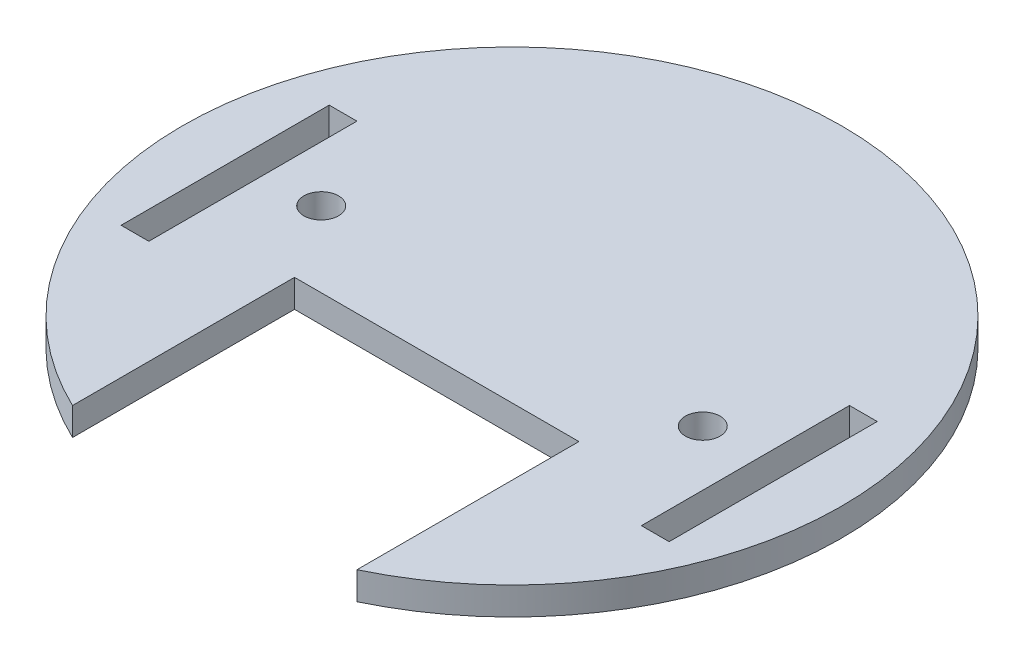
from build123d import *

# Parameters (mm, degrees)
SKETCH1_R           = 2.5
BOSS_EXTRUDE2_DEPTH = 4


with BuildPart() as part:
    # Sketch1 → Boss-Extrude2 (new body)
    with BuildSketch(Plane(origin=(0, 0, 0), x_dir=(1, 0, 0), z_dir=(0, 1, 0))):
        with BuildLine():
            Line((-20.5, -42.848570571), (-20.5, -10.848570571))
            Line((-20.5, -10.848570571), (20.5, -10.848570571))
            Line((20.5, -10.848570571), (20.5, -42.848570571))
            ThreePointArc((20.5, -42.848570571), (0, 47.5), (-20.5, -42.848570571))
        make_face()
        with Locations((-27.5, 0)):
            Circle(SKETCH1_R, mode=Mode.SUBTRACT)
        with Locations((27.5, 0)):
            Circle(SKETCH1_R, mode=Mode.SUBTRACT)
        Polygon((35.5, -16.848570571), (39.5, -16.848570571), (39.5, 13.151429429), (35.5, 13.151429429), (35.5, 9.151429429), align=None, mode=Mode.SUBTRACT)
        Polygon((-35.5, -16.848570571), (-39.5, -16.848570571), (-39.5, 13.151429429), (-35.5, 13.151429429), (-35.5, 9.151429429), align=None, mode=Mode.SUBTRACT)
    extrude(amount=BOSS_EXTRUDE2_DEPTH)


solid = part.part
